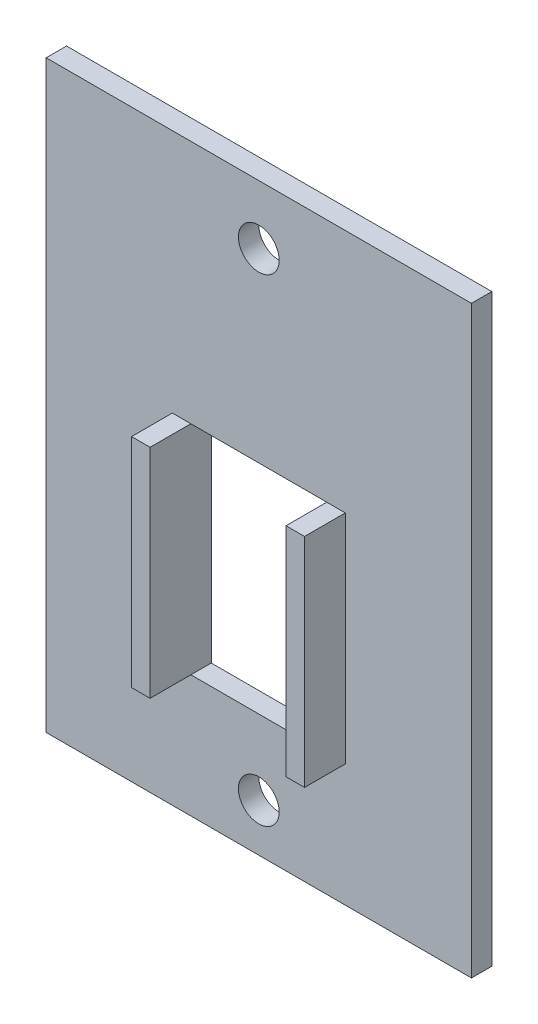
from build123d import *

# Parameters (mm, degrees)
SKETCH_1_R          = 1.5
SKETCH_1_W          = 10
SKETCH_1_H          = 16
EXTRUDE_1_DEPTH     = 1.5
SKETCH_2_R          = 1.5
CUT_EXTRUDE_1_DEPTH = 10
SKETCH_3_W          = 1.364235862
SKETCH_3_H          = 16
EXTRUDE_2_DEPTH     = 3


with BuildPart() as part:
    # 草图1 → 凸台-拉伸1 (new body)
    with BuildSketch(Plane.XY):
        Polygon((15.65, -14.6), (15.65, 19.612875536), (15.65, 26.939884515), (-15.65, 26.939884515), (-15.65, -16.060115485), (15.65, -16.060115485), align=None)
        with Locations((0, -12.560115485)):
            Circle(SKETCH_1_R, mode=Mode.SUBTRACT)
        with Locations((0, 0.939884515)):
            Rectangle(SKETCH_1_W, SKETCH_1_H, mode=Mode.SUBTRACT)
    extrude(amount=EXTRUDE_1_DEPTH)

    # 草图2 → 切除-拉伸1 (cut)
    with BuildSketch(Plane(origin=(0, 0, 0), x_dir=(-1, 0, 0), z_dir=(0, 0, -1))):
        with Locations((0, 22.602985909)):
            Circle(SKETCH_2_R)
    extrude(amount=-CUT_EXTRUDE_1_DEPTH, mode=Mode.SUBTRACT)

    # 草图3 → 凸台-拉伸2 (add)
    with BuildSketch(Plane.XY.offset(1.5)):
        with Locations((5.682117931, 0.939884515)):
            Rectangle(SKETCH_3_W, SKETCH_3_H)
        with Locations((-5.682117931, 0.939884515)):
            Rectangle(SKETCH_3_W, SKETCH_3_H)
    extrude(amount=EXTRUDE_2_DEPTH)


solid = part.part
